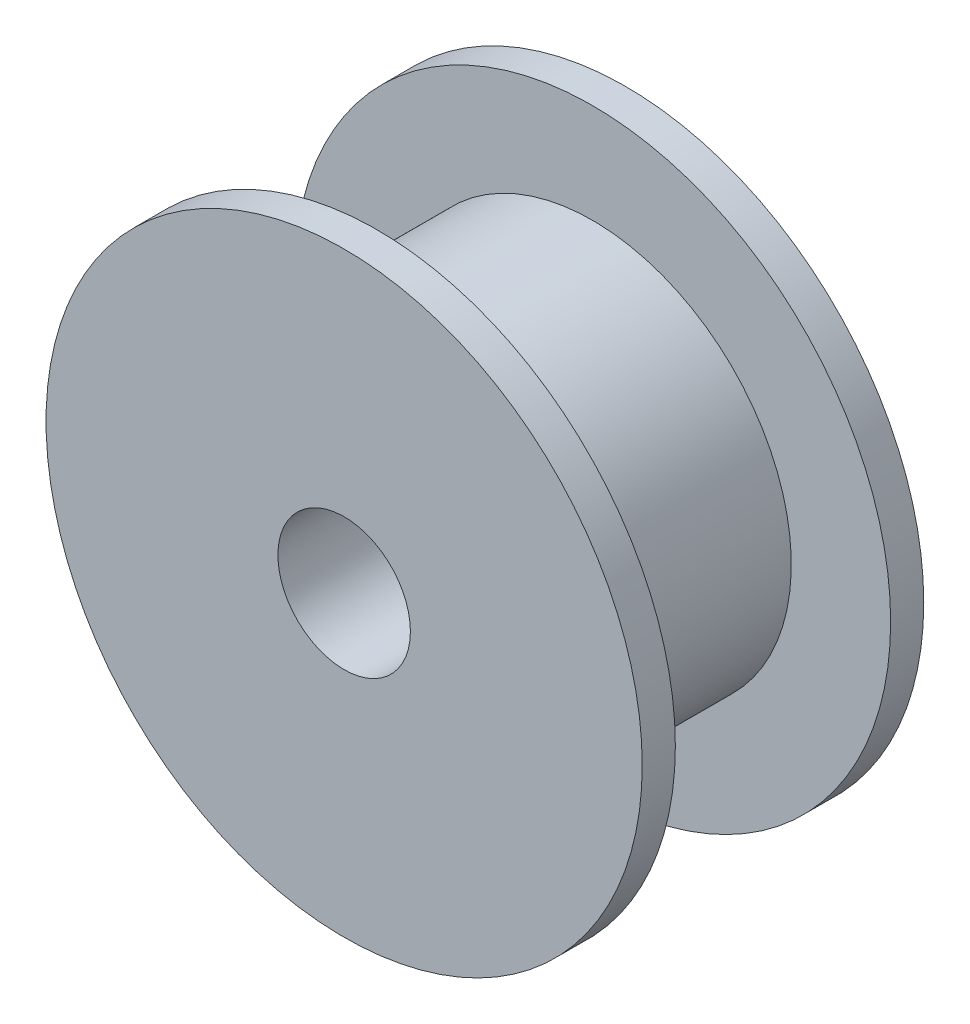
from build123d import *

# Parameters (mm, degrees)
CROQUIS1_R              = 9
CROQUIS1_R_2            = 2
SALIENTE_EXTRUIR1_DEPTH = 1
CROQUIS2_R              = 6
CROQUIS2_R_2            = 2
SALIENTE_EXTRUIR2_DEPTH = 6.5
CROQUIS3_R              = 9
CROQUIS3_R_2            = 2
SALIENTE_EXTRUIR3_DEPTH = 1


with BuildPart() as part:
    # Croquis1 → Saliente-Extruir1 (new body)
    with BuildSketch(Plane.XY):
        Circle(CROQUIS1_R)
        Circle(CROQUIS1_R_2, mode=Mode.SUBTRACT)
    extrude(amount=SALIENTE_EXTRUIR1_DEPTH)

    # Croquis2 → Saliente-Extruir2 (add)
    with BuildSketch(Plane.XY.offset(1)):
        Circle(CROQUIS2_R)
        Circle(CROQUIS2_R_2, mode=Mode.SUBTRACT)
    extrude(amount=SALIENTE_EXTRUIR2_DEPTH)

    # Croquis3 → Saliente-Extruir3 (add)
    with BuildSketch(Plane.XY.offset(7.5)):
        Circle(CROQUIS3_R)
        Circle(CROQUIS3_R_2, mode=Mode.SUBTRACT)
    extrude(amount=SALIENTE_EXTRUIR3_DEPTH)


solid = part.part
